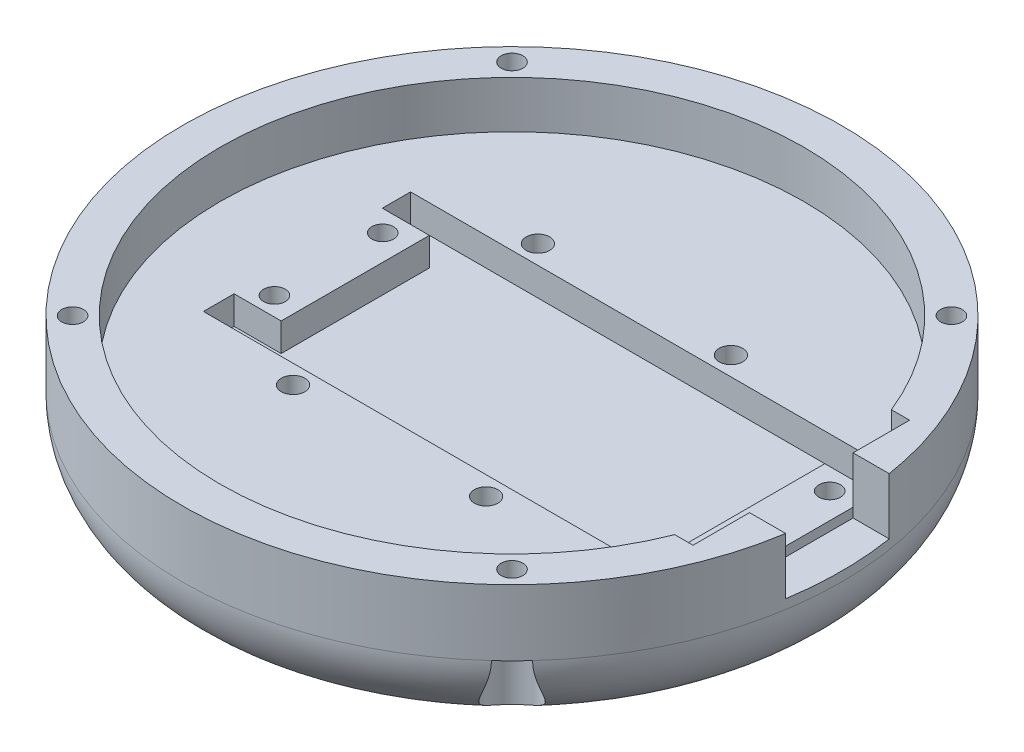
from build123d import *

# Parameters (mm, degrees)
SKETCH1_R               = 35
BOSS_EXTRUDE1_DEPTH     = 10
SKETCH2_R               = 1.15
CUT_EXTRUDE1_DEPTH      = 3
BOSS_EXTRUDE2_DEPTH     = 5
CUT_EXTRUDE3_DEPTH      = 52.720402164
CUT_EXTRUDE3_DEPTH_BACK = 52.720402164
SKETCH12_R              = 1.15
CUT_EXTRUDE4_START      = -8
CUT_EXTRUDE4_OUTLINE_R  = 1.15
CUT_EXTRUDE4_DEPTH      = 9
SKETCH14_R              = 22.5
CUT_EXTRUDE5_DEPTH      = 2
SKETCH15_R              = 1.25
CUT_EXTRUDE6_DEPTH      = 6
CUT_EXTRUDE7_START      = -1
CUT_EXTRUDE7_DEPTH      = 6


with BuildPart() as part:
    # Sketch1 → Boss-Extrude1 (new body)
    with BuildSketch(Plane(origin=(0, 0, 0), x_dir=(1, 0, 0), z_dir=(0, 1, 0))):
        with Locations(Location((0, 0, 0), (0, 0, 270))):
            Circle(SKETCH1_R)
    extrude(amount=BOSS_EXTRUDE1_DEPTH)

    # Sketch2 → Cut-Extrude1 (cut)
    with BuildSketch(Plane(origin=(0, 10, 0), x_dir=(1, 0, 0), z_dir=(0, 1, 0))):
        Polygon((-21.773504548, -7.743563281), (-21.773504548, -11), (30.226495452, -11), (30.226495452, -8), (25.226495452, -8), (25.226495452, 8), (30.226495452, 8), (30.226495452, 11), (-21.773504548, 11), (-21.773504548, 8), (-16.773504548, 8), (-16.773504548, -7.743563281), align=None)
        with Locations(Location((-19.480382443, -5.75, 0), (0, 0, 270))):
            Circle(SKETCH2_R)
        with Locations(Location((-19.480382443, 5.75, 0), (0, 0, 270))):
            Circle(SKETCH2_R)
        with Locations(Location((27.993107277, 5.75, 0), (0, 0, 270))):
            Circle(SKETCH2_R)
        with Locations(Location((27.993107277, -5.75, 0), (0, 0, 270))):
            Circle(SKETCH2_R)
    extrude(amount=-CUT_EXTRUDE1_DEPTH, mode=Mode.SUBTRACT)

    # Sketch3 → Boss-Extrude2 (add)
    with BuildSketch(Plane(origin=(0, 10, 0), x_dir=(1, 0, 0), z_dir=(0, 1, 0))):
        with BuildLine():
            Line((30.726495452, 11.5), (30.726495452, 5.5))
            Line((30.726495452, 5.5), (34.565155865, 5.5))
            ThreePointArc((34.565155865, 5.5), (-35, 0), (34.565155865, -5.5))
            Line((34.565155865, -5.5), (30.726495452, -5.5))
            Line((30.726495452, -5.5), (30.726495452, -11.5))
            Line((30.726495452, -11.5), (28.788018341, -11.5))
            ThreePointArc((28.788018341, -11.5), (-31, 0), (28.788018341, 11.5))
            Line((28.788018341, 11.5), (30.726495452, 11.5))
        make_face()
    extrude(amount=BOSS_EXTRUDE2_DEPTH)

    # Sketch12 → Cut-Extrude3 (cut, two sides: drawn at the far end of the back side and taken through both)
    with BuildSketch(Plane.XZ.offset(-CUT_EXTRUDE3_DEPTH_BACK)):
        with Locations(Location((-23.334523779, 23.334523779, 0), (0, 0, 270))):
            Circle(SKETCH12_R)
        with Locations(Location((23.334523779, 23.334523779, 0), (0, 0, 270))):
            Circle(SKETCH12_R)
        with Locations(Location((23.334523779, -23.334523779, 0), (0, 0, 270))):
            Circle(SKETCH12_R)
        with Locations(Location((-23.334523779, -23.334523779, 0), (0, 0, 270))):
            Circle(SKETCH12_R)
    extrude(amount=CUT_EXTRUDE3_DEPTH + CUT_EXTRUDE3_DEPTH_BACK, mode=Mode.SUBTRACT)

    # Cut-Extrude4: read off the stored shape, not the designer's step
    # Cut-Extrude4 outline → Cut-Extrude4 (cut)
    # profile 1 of 4: a face of its own
    with BuildSketch(Plane.XZ.offset(CUT_EXTRUDE4_START)):
        with BuildLine():
            ThreePointArc((-25.816694029, -23.632568828), (-24.748737342, -24.748737342), (-23.632568828, -25.816694029))
            ThreePointArc((-23.632568828, -25.816694029), (-21.566756826, -21.566756826), (-25.816694029, -23.632568828))
        make_face()
        with Locations((-23.334523779, -23.334523779)):
            Circle(CUT_EXTRUDE4_OUTLINE_R, mode=Mode.SUBTRACT)
    # profile 2 of 4: a face of its own
    with BuildSketch(Plane.XZ.offset(CUT_EXTRUDE4_START)):
        with BuildLine():
            ThreePointArc((25.816694029, -23.632568828), (21.566756826, -21.566756826), (23.632568828, -25.816694029))
            ThreePointArc((23.632568828, -25.816694029), (24.748737342, -24.748737342), (25.816694029, -23.632568828))
        make_face()
        with Locations((23.334523779, -23.334523779)):
            Circle(CUT_EXTRUDE4_OUTLINE_R, mode=Mode.SUBTRACT)
    # profile 3 of 4: a face of its own
    with BuildSketch(Plane.XZ.offset(CUT_EXTRUDE4_START)):
        with BuildLine():
            ThreePointArc((-23.632568828, 25.816694029), (-24.748737342, 24.748737342), (-25.816694029, 23.632568828))
            ThreePointArc((-25.816694029, 23.632568828), (-21.566756826, 21.566756826), (-23.632568828, 25.816694029))
        make_face()
        with Locations((-23.334523779, 23.334523779)):
            Circle(CUT_EXTRUDE4_OUTLINE_R, mode=Mode.SUBTRACT)
    # profile 4 of 4: a face of its own
    with BuildSketch(Plane.XZ.offset(CUT_EXTRUDE4_START)):
        with BuildLine():
            ThreePointArc((25.816694029, 23.632568828), (24.748737342, 24.748737342), (23.632568828, 25.816694029))
            ThreePointArc((23.632568828, 25.816694029), (21.566756826, 21.566756826), (25.816694029, 23.632568828))
        make_face()
        with Locations((23.334523779, 23.334523779)):
            Circle(CUT_EXTRUDE4_OUTLINE_R, mode=Mode.SUBTRACT)
    extrude(amount=CUT_EXTRUDE4_DEPTH, mode=Mode.SUBTRACT)

    # Fillet2: read off the stored shape, not the designer's step
    # Fillet2 outline → Fillet2 (revolve, cut)
    with BuildSketch(Plane.XY):
        with BuildLine():
            ThreePointArc((35, 8), (32.656854249, 2.343145751), (27, 0))
            Line((27, 0), (35, 0))
            Line((35, 0), (35, 8))
        make_face()
    revolve(axis=Axis((0, 0, 0), (0, 1, 0)), mode=Mode.SUBTRACT)

    # Sketch14 → Cut-Extrude5 (cut)
    with BuildSketch(Plane.XZ):
        with Locations(Location((0, 0, 0), (0, 0, 270))):
            Circle(SKETCH14_R)
    extrude(amount=-CUT_EXTRUDE5_DEPTH, mode=Mode.SUBTRACT)

    # Sketch15 → Cut-Extrude6 (cut)
    with BuildSketch(Plane(origin=(0, 10, 0), x_dir=(1, 0, 0), z_dir=(0, 1, 0))):
        with Locations(Location((-10.25, 13, 0), (0, 0, 270))):
            Circle(SKETCH15_R)
        with Locations(Location((-10.25, -13, 0), (0, 0, 270))):
            Circle(SKETCH15_R)
        with Locations(Location((10.25, 13, 0), (0, 0, 270))):
            Circle(SKETCH15_R)
        with Locations(Location((10.25, -13, 0), (0, 0, 270))):
            Circle(SKETCH15_R)
    extrude(amount=-CUT_EXTRUDE6_DEPTH, mode=Mode.SUBTRACT)

    # Cut-Extrude7: read off the stored shape, not the designer's step
    # Cut-Extrude7 outline → Cut-Extrude7 (cut)
    with BuildSketch(Plane(origin=(0, 10, 0), x_dir=(1, 0, 0), z_dir=(0, 1, 0)).offset(CUT_EXTRUDE7_START)):
        with BuildLine():
            ThreePointArc((34.565155865, -5.5), (35, 0), (34.565155865, 5.5))
            Line((34.565155865, 5.5), (30.726495452, 5.5))
            Line((30.726495452, 5.5), (30.726495452, -5.5))
            Line((30.726495452, -5.5), (34.565155865, -5.5))
        make_face()
    extrude(amount=CUT_EXTRUDE7_DEPTH, mode=Mode.SUBTRACT)


solid = part.part
